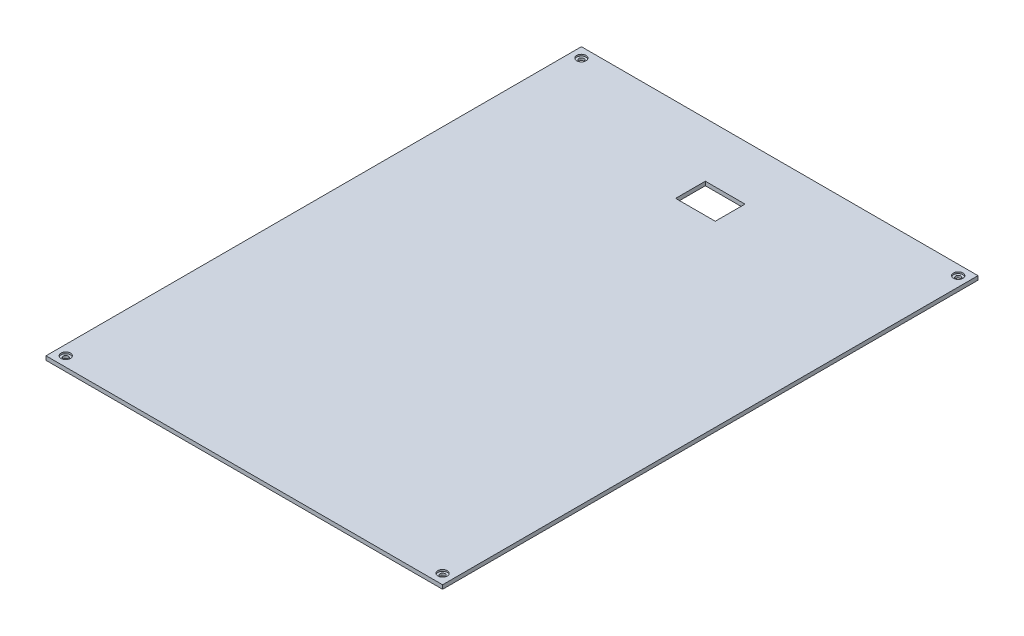
from build123d import *

# Parameters (mm, degrees)
SKETCH_1_W          = 200
SKETCH_1_H          = 270
EXTRUDE_1_DEPTH     = 2
SKETCH_2_R          = 1.3
CUT_EXTRUDE_1_DEPTH = 169.014880293
SKETCH_3_R          = 2.375
CUT_EXTRUDE_2_DEPTH = 0.8
SKETCH_4_W          = 20
SKETCH_4_H          = 15
CUT_EXTRUDE_3_DEPTH = 169.014880293
SKETCH_5_R          = 2.75
SKETCH_5_R_2        = 1.75
EXTRUDE_2_DEPTH     = 2.7


with BuildPart() as part:
    # Эскиз1 → Бобышка-Вытянуть1 (new body)
    with BuildSketch(Plane(origin=(0, 0, 0), x_dir=(1, 0, 0), z_dir=(0, 1, 0))):
        Rectangle(SKETCH_1_W, SKETCH_1_H)
    extrude(amount=EXTRUDE_1_DEPTH)

    # Эскиз2 → Вырез-Вытянуть1 (cut, through all)
    with BuildSketch(Plane(origin=(0, 2, 0), x_dir=(1, 0, 0), z_dir=(0, 1, 0))):
        with Locations((-95.01023, 130.01023)):
            Circle(SKETCH_2_R)
        with Locations((95.01023, 130.01023)):
            Circle(SKETCH_2_R)
        with Locations((95.01023, -130.01023)):
            Circle(SKETCH_2_R)
        with Locations((-95.01023, -130.01023)):
            Circle(SKETCH_2_R)
    extrude(amount=-CUT_EXTRUDE_1_DEPTH, mode=Mode.SUBTRACT)

    # Эскиз3 → Вырез-Вытянуть2 (cut)
    with BuildSketch(Plane(origin=(0, 2, 0), x_dir=(1, 0, 0), z_dir=(0, 1, 0))):
        with Locations((-95.01023, 130.01023)):
            Circle(SKETCH_3_R)
        with Locations((95.01023, 130.01023)):
            Circle(SKETCH_3_R)
        with Locations((-95.01023, -130.01023)):
            Circle(SKETCH_3_R)
        with Locations((95.01023, -130.01023)):
            Circle(SKETCH_3_R)
    extrude(amount=-CUT_EXTRUDE_2_DEPTH, mode=Mode.SUBTRACT)

    # Эскиз4 → Вырез-Вытянуть3 (cut, through all)
    with BuildSketch(Plane(origin=(0, 2, 0), x_dir=(1, 0, 0), z_dir=(0, 1, 0))):
        with Locations((0, 100)):
            Rectangle(SKETCH_4_W, SKETCH_4_H)
    extrude(amount=-CUT_EXTRUDE_3_DEPTH, mode=Mode.SUBTRACT)

    # Эскиз5 → Бобышка-Вытянуть2 (add)
    # profile 1 of 2: a face of its own
    with BuildSketch(Plane.XZ):
        with Locations((-3.9, -120.15)):
            Circle(SKETCH_5_R)
        with Locations((-3.9, -120.15)):
            Circle(SKETCH_5_R_2, mode=Mode.SUBTRACT)
    # profile 2 of 2: a face of its own
    with BuildSketch(Plane.XZ):
        with Locations((6.25, -88.45)):
            Circle(SKETCH_5_R)
        with Locations((6.25, -88.45)):
            Circle(SKETCH_5_R_2, mode=Mode.SUBTRACT)
    extrude(amount=EXTRUDE_2_DEPTH)


solid = part.part
